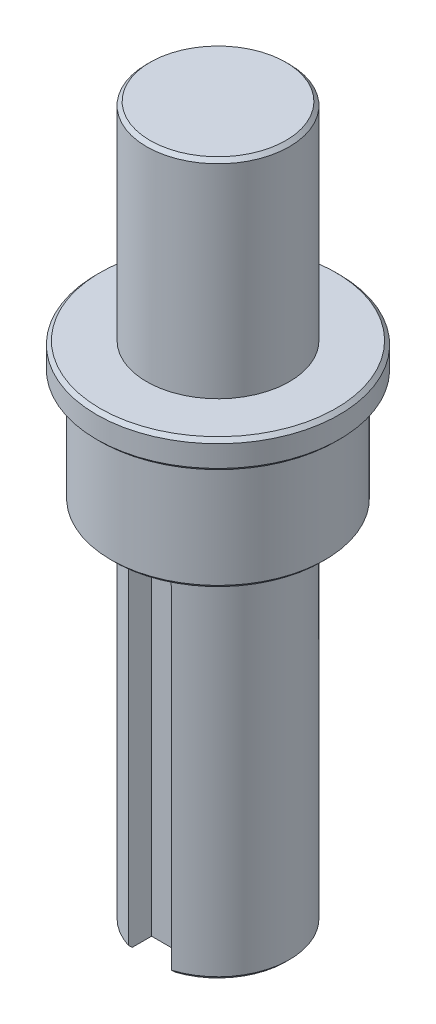
from build123d import *

# Parameters (mm, degrees)
TAP_DRILL_FOR_M4_TAP1_D     = 3.3
TAP_DRILL_FOR_M4_TAP1_DEPTH = 10
TAP_DRILL_FOR_M4_TAP1_TIP   = 0.991420021
CHAMFER1_SIZE               = 0.25
SKETCH4_W                   = 3
SKETCH4_H                   = 3
CUT_EXTRUDE1_DEPTH          = 25
FILLET1_R                   = 1.5


with BuildPart() as part:
    # Sketch1 → Revolve1 (revolve)
    with BuildSketch(Plane.XY, mode=Mode.PRIVATE) as revolve1_sk:
        Polygon((0, 55.365578046), (5, 55.365578046), (5, 40.865578046), (8.5, 40.865578046), (8.5, 38.865578046), (7.5, 38.865578046), (7.5, 31.065578046), (5, 31.065578046), (5, 5.565578046), (0, 5.565578046), align=None)
    revolve(revolve1_sk.sketch.rotate(Axis((0, 0, 0), (0, 1, 0)), 90), axis=Axis((0, 0, 0), (0, 1, 0)))

    # Tap Drill for M4 Tap1
    with Locations(Plane(origin=(0, 5.565578046, 0), x_dir=(-1, 0, 0), z_dir=(0, -1, 0))):
        with Locations((0, 0)):
            Hole(TAP_DRILL_FOR_M4_TAP1_D / 2, depth=TAP_DRILL_FOR_M4_TAP1_DEPTH)
            with Locations((0, 0, -(TAP_DRILL_FOR_M4_TAP1_DEPTH + TAP_DRILL_FOR_M4_TAP1_TIP / 2))):  # 118° drill point
                Cone(0, TAP_DRILL_FOR_M4_TAP1_D / 2, TAP_DRILL_FOR_M4_TAP1_TIP, mode=Mode.SUBTRACT)

    # Chamfer1
    chamfer1_edges = [part.edges().sort_by_distance(p)[0] for p in [
        (0, 55.365578046, 5),
        (-1.65, 5.565578046, 0),
        (0, 5.565578046, 5),
        (0, 31.065578046, 7.5),
        (0, 38.865578046, 8.5),
        (0, 40.865578046, 8.5),
    ]]
    chamfer(chamfer1_edges, length=CHAMFER1_SIZE)

    # Sketch4 → Cut-Extrude1 (cut)
    with BuildSketch(Plane.XZ.offset(-5.565578046)):
        with Locations((0, 4.65)):
            Rectangle(SKETCH4_W, SKETCH4_H)
    extrude(amount=-CUT_EXTRUDE1_DEPTH, mode=Mode.SUBTRACT)

    # Fillet1
    fillet1_edges = [part.edges().sort_by_distance(p)[0] for p in [
        (1.5, 30.565578046, 3.959848004),
        (-1.5, 30.565578046, 3.959848004),
    ]]
    fillet(fillet1_edges, radius=FILLET1_R - 0.0001)  # a hair under: the kernel refuses the full size


solid = part.part
